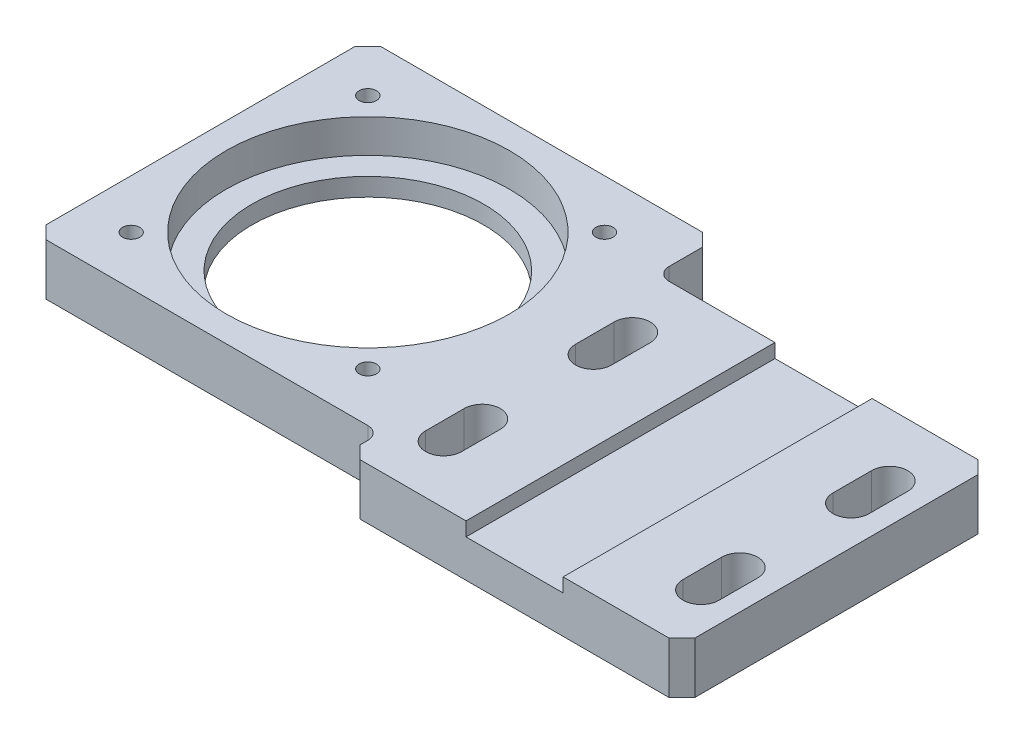
from build123d import *

# Parameters (mm, degrees)
EXTRUDE_1_DEPTH     = 20
SKETCH_3_R          = 45
CUT_EXTRUDE_1_DEPTH = 302.784691461
SKETCH_4_R          = 55
CUT_EXTRUDE_2_DEPTH = 13
SKETCH_5_W          = 37.703420814
SKETCH_5_H          = 120
CUT_EXTRUDE_3_DEPTH = 5.4
CUT_EXTRUDE_4_DEPTH = 302.784691461
FILLET_1_R          = 5
CHAMFER_1_SIZE      = 5
SKETCH_7_R          = 3.35
CUT_EXTRUDE_5_DEPTH = 302.784691461


with BuildPart() as part:
    # 草图2 → 凸台-拉伸1 (new body)
    with BuildSketch(Plane(origin=(0, 0, 0), x_dir=(1, 0, 0), z_dir=(0, 1, 0))):
        Polygon((0, 0), (135, 0), (135, -23), (265, -23), (265, -143), (135, -143), (135, -130), (0, -130), align=None)
    extrude(amount=EXTRUDE_1_DEPTH)

    # 草图3 → 切除-拉伸1 (cut, through all)
    with BuildSketch(Plane(origin=(0, 20, 0), x_dir=(1, 0, 0), z_dir=(0, 1, 0))):
        with Locations((65, -65)):
            Circle(SKETCH_3_R)
    extrude(amount=-CUT_EXTRUDE_1_DEPTH, mode=Mode.SUBTRACT)

    # 草图4 → 切除-拉伸2 (cut)
    with BuildSketch(Plane(origin=(0, 20, 0), x_dir=(1, 0, 0), z_dir=(0, 1, 0))):
        with Locations((65, -65)):
            Circle(SKETCH_4_R)
    extrude(amount=-CUT_EXTRUDE_2_DEPTH, mode=Mode.SUBTRACT)

    # 草图5 → 切除-拉伸3 (cut)
    with BuildSketch(Plane(origin=(0, 20, 0), x_dir=(1, 0, 0), z_dir=(0, 1, 0))):
        with Locations((200, -83)):
            Rectangle(SKETCH_5_W, SKETCH_5_H)
    extrude(amount=-CUT_EXTRUDE_3_DEPTH, mode=Mode.SUBTRACT)

    # 草图6 → 切除-拉伸4 (cut, through all)
    with BuildSketch(Plane(origin=(0, 20, 0), x_dir=(1, 0, 0), z_dir=(0, 1, 0))):
        with BuildLine():
            Line((157, -47.312507702), (157, -62.312507702))
            ThreePointArc((157, -62.312507702), (150, -69.312507702), (143, -62.312507702))
            Line((143, -62.312507702), (143, -47.312507702))
            ThreePointArc((143, -47.312507702), (150, -40.312507702), (157, -47.312507702))
        make_face()
        with BuildLine():
            Line((157, -105.55824709), (157, -120.55824709))
            ThreePointArc((157, -120.55824709), (150, -127.55824709), (143, -120.55824709))
            Line((143, -120.55824709), (143, -105.55824709))
            ThreePointArc((143, -105.55824709), (150, -98.55824709), (157, -105.55824709))
        make_face()
        with BuildLine():
            Line((257, -47.312507702), (257, -62.312507702))
            ThreePointArc((257, -62.312507702), (250, -69.312507702), (243, -62.312507702))
            Line((243, -62.312507702), (243, -47.312507702))
            ThreePointArc((243, -47.312507702), (250, -40.312507702), (257, -47.312507702))
        make_face()
        with BuildLine():
            Line((257, -105.55824709), (257, -120.55824709))
            ThreePointArc((257, -120.55824709), (250, -127.55824709), (243, -120.55824709))
            Line((243, -120.55824709), (243, -105.55824709))
            ThreePointArc((243, -105.55824709), (250, -98.55824709), (257, -105.55824709))
        make_face()
    extrude(amount=-CUT_EXTRUDE_4_DEPTH, mode=Mode.SUBTRACT)

    # 圆角1
    fillet_1_edges = [part.edges().sort_by_distance(p)[0] for p in [
        (135, 10, 23),
        (135, 10, 130),
    ]]
    fillet(fillet_1_edges, radius=FILLET_1_R)

    # 倒角1
    chamfer_1_edges = [part.edges().sort_by_distance(p)[0] for p in [
        (265, 10, 23),
        (265, 10, 143),
        (135, 10, 143),
        (135, 10, 0),
        (0, 10, 130),
        (0, 10, 0),
    ]]
    chamfer(chamfer_1_edges, length=CHAMFER_1_SIZE)

    # 草图7 → 切除-拉伸5 (cut, through all)
    with BuildSketch(Plane(origin=(0, 20, 0), x_dir=(1, 0, 0), z_dir=(0, 1, 0))):
        with Locations((110.961940777, -19.038059223)):
            Circle(SKETCH_7_R)
        with Locations((110.961940777, -110.961940777)):
            Circle(SKETCH_7_R)
        with Locations((19.038059223, -110.961940777)):
            Circle(SKETCH_7_R)
        with Locations((19.038059223, -19.038059223)):
            Circle(SKETCH_7_R)
    extrude(amount=-CUT_EXTRUDE_5_DEPTH, mode=Mode.SUBTRACT)


solid = part.part
